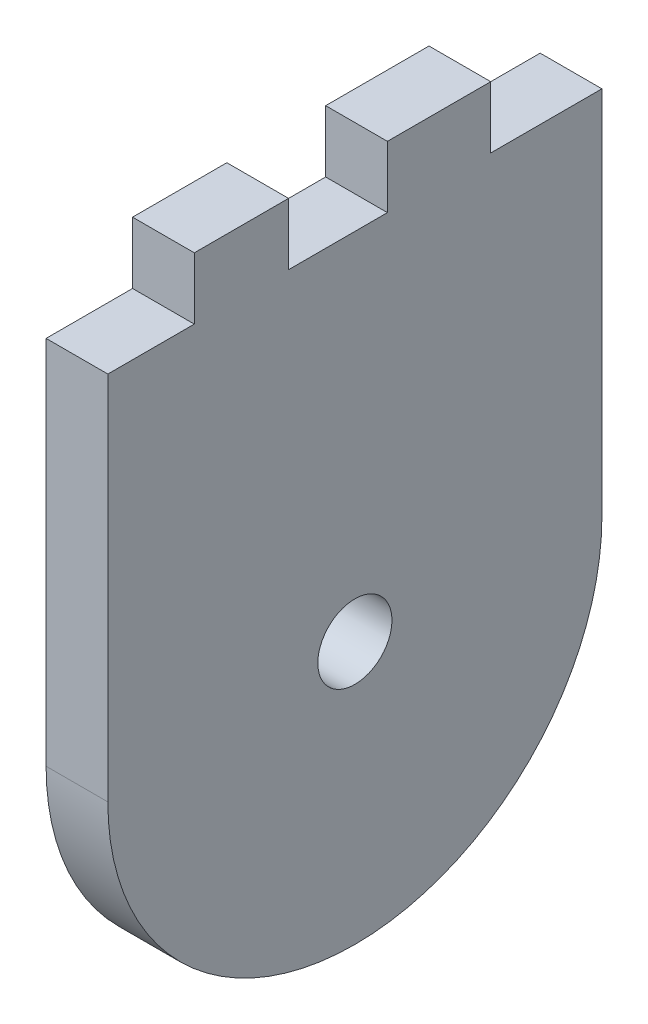
from build123d import *

# Parameters (mm, degrees)
DODANIE_WYCI_GNI_CIE1_DEPTH = 40
ZAOKR_GLENIE1_R             = 20
SZKIC6_R                    = 3
WYTNIJ_WYCI_GNI_CIE1_DEPTH  = 10
WYTNIJ_WYCI_GNI_CIE2_DEPTH  = 69.190908485


with BuildPart() as part:
    # Szkic1 → Dodanie-wyciągnięcie1 (new body)
    with BuildSketch(Plane.XY):
        Polygon((0, 0), (-5, 0), (-5, 55), (0, 55), (0, 51.5), align=None)
    extrude(amount=DODANIE_WYCI_GNI_CIE1_DEPTH)

    # Zaokrąglenie1
    zaokr_glenie1_edges = [part.edges().sort_by_distance(p)[0] for p in [
        (-2.5, 0, 0),
        (-2.5, 0, 40),
    ]]
    fillet(zaokr_glenie1_edges, radius=ZAOKR_GLENIE1_R - 0.0001)  # a hair under: the kernel refuses the full size

    # Szkic6 → Wytnij-wyciągnięcie1 (cut)
    with BuildSketch(Plane.ZY.offset(5)):
        with Locations((20, 21.237598079)):
            Circle(SZKIC6_R)
    extrude(amount=-WYTNIJ_WYCI_GNI_CIE1_DEPTH, mode=Mode.SUBTRACT)

    # Szkic8 → Wytnij-wyciągnięcie2 (cut, through all)
    with BuildSketch(Plane.ZY.offset(5)):
        Polygon((0, 50), (9, 50), (9, 55), (17.366037593, 55), (17.366037593, 50), (25.366037593, 50), (25.366037593, 55), (33, 55), (33, 50), (40, 50), (40, 57.074314744), (0, 57.074314744), align=None)
    extrude(amount=-WYTNIJ_WYCI_GNI_CIE2_DEPTH, mode=Mode.SUBTRACT)


solid = part.part
